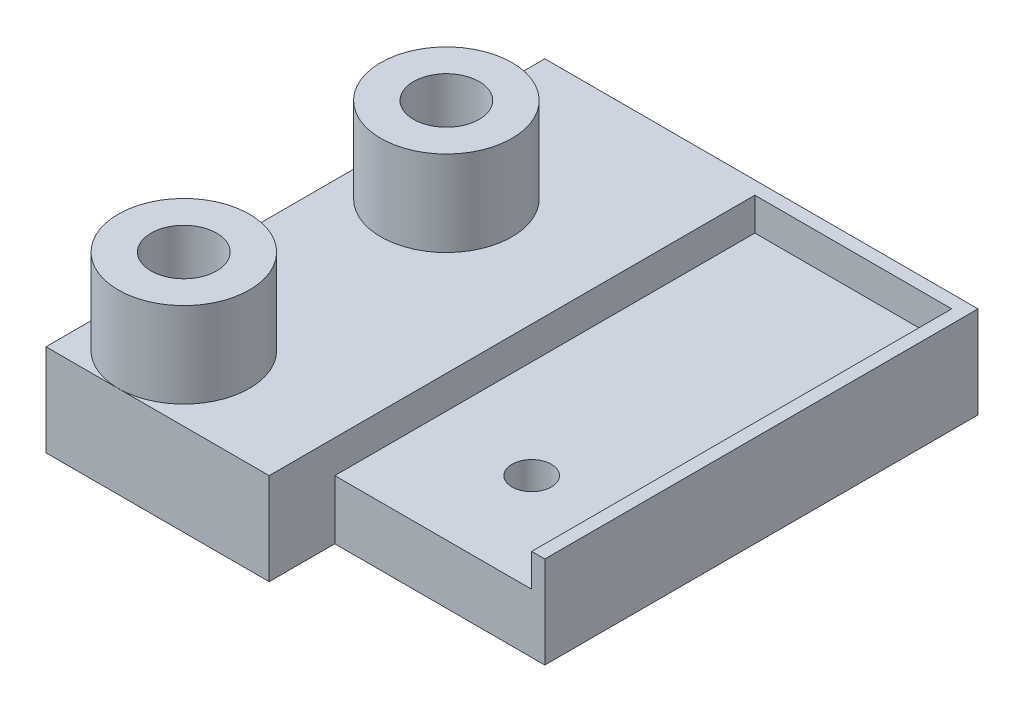
from build123d import *

# Parameters (mm, degrees)
SKETCH1_W                = 33
SKETCH1_H                = 33
BOSS_EXTRUDE1_DEPTH      = 7
SKETCH2_W                = 15
SKETCH2_H                = 32
CUT_EXTRUDE1_DEPTH       = 2.5
SKETCH4_W                = 17
SKETCH4_H                = 5
BOSS_EXTRUDE3_DEPTH      = 7
SKETCH3_R                = 5
SKETCH3_R_2              = 2.5
BOSS_EXTRUDE4_DEPTH      = 6.5
CUT_EXTRUDE4_START       = -7
CUT_EXTRUDE4_OUTLINE_R   = 2.5
CUT_EXTRUDE4_OUTLINE_R_2 = 1.5
CUT_EXTRUDE4_DEPTH       = 7


# Read off the part's stored shape, not the designer's step: Cut-Extrude4
with BuildPart() as part:
    # Sketch1 → Boss-Extrude1 (new body)
    with BuildSketch(Plane(origin=(0, 0, 0), x_dir=(1, 0, 0), z_dir=(0, 1, 0))):
        with Locations((-16.5, 16.5)):
            Rectangle(SKETCH1_W, SKETCH1_H)
    extrude(amount=BOSS_EXTRUDE1_DEPTH)

    # Sketch2 → Cut-Extrude1 (cut)
    with BuildSketch(Plane(origin=(0, 7, 0), x_dir=(1, 0, 0), z_dir=(0, 1, 0))):
        with Locations((-8.5, 16)):
            Rectangle(SKETCH2_W, SKETCH2_H)
    extrude(amount=-CUT_EXTRUDE1_DEPTH, mode=Mode.SUBTRACT)

    # Sketch4 → Boss-Extrude3 (add)
    with BuildSketch(Plane(origin=(0, 7, 0), x_dir=(1, 0, 0), z_dir=(0, 1, 0))):
        with Locations((-24.5, -2.5)):
            Rectangle(SKETCH4_W, SKETCH4_H)
    extrude(amount=-BOSS_EXTRUDE3_DEPTH)

    # Sketch3 → Boss-Extrude4 (add)
    # profile 1 of 2: a face of its own
    with BuildSketch(Plane(origin=(0, 7, 0), x_dir=(1, 0, 0), z_dir=(0, 1, 0))):
        with Locations(Location((-27.5, 20, 0), (0, 0, 90))):
            Circle(SKETCH3_R)
        with Locations(Location((-27.5, 20, 0), (0, 0, 90))):
            Circle(SKETCH3_R_2, mode=Mode.SUBTRACT)
    # profile 2 of 2: a face of its own
    with BuildSketch(Plane(origin=(0, 7, 0), x_dir=(1, 0, 0), z_dir=(0, 1, 0))):
        with Locations(Location((-27.5, 0, 0), (0, 0, 270))):
            Circle(SKETCH3_R)
        with Locations(Location((-27.5, 0, 0), (0, 0, 90))):
            Circle(SKETCH3_R_2, mode=Mode.SUBTRACT)
    extrude(amount=BOSS_EXTRUDE4_DEPTH)

    # Cut-Extrude4 outline → Cut-Extrude4 (cut)
    with BuildSketch(Plane(origin=(0, 7, 0), x_dir=(1, 0, 0), z_dir=(0, 1, 0)).offset(CUT_EXTRUDE4_START)):
        with Locations((-27.5, 20)):
            Circle(CUT_EXTRUDE4_OUTLINE_R)
        with Locations((-27.5, 0)):
            Circle(CUT_EXTRUDE4_OUTLINE_R)
        with Locations((-8.5, 7.5)):
            Circle(CUT_EXTRUDE4_OUTLINE_R_2)
    extrude(amount=CUT_EXTRUDE4_DEPTH, mode=Mode.SUBTRACT)


solid = part.part
